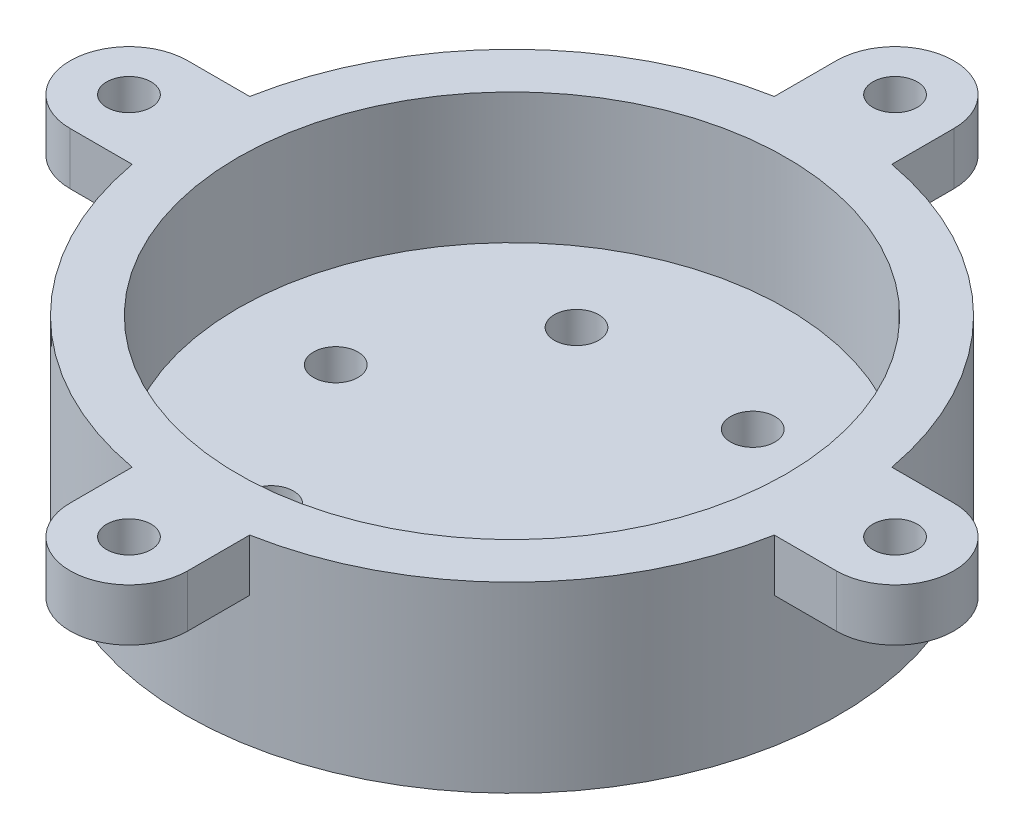
from build123d import *

# Parameters (mm, degrees)
SKETCH_1_R                   = 25
SKETCH_1_R_2                 = 21
EXTRUDE_1_DEPTH              = 10
EXTRUDE_START                = -4
SKETCH_1_5_R                 = 25
EXTRUDE_2_DEPTH              = 4
EXTRUDE_3_DEPTH              = 4
PATTERN_CIRCULAR_1_COUNT     = 6
HOLE_WIZARD_M3_2_D           = 3.4
HOLE_WIZARD_M3_2_CSINK_D     = 3.45
HOLE_WIZARD_M3_2_CSINK_ANGLE = 90


# Read off the part's stored shape, not the designer's step: M3 间隙孔1
with BuildPart() as part:
    # 草图1 → 拉伸-薄壁1 (new body)
    with BuildSketch(Plane(origin=(0, 0, 0), x_dir=(1, 0, 0), z_dir=(0, 1, 0))):
        Circle(SKETCH_1_R)
        Circle(SKETCH_1_R_2, mode=Mode.SUBTRACT)
    extrude(amount=EXTRUDE_1_DEPTH)

    # 草图1<5> → 凸台-拉伸2 (add)
    with BuildSketch(Plane(origin=(0, 0, 0), x_dir=(1, 0, 0), z_dir=(0, 1, 0)).offset(EXTRUDE_START)):
        with Locations(Location((0, 0, 0), (0, 0, 270))):
            Circle(SKETCH_1_5_R)
    extrude(amount=EXTRUDE_2_DEPTH)

    # 草图3 → 凸台-拉伸3 (add)
    with BuildSketch(Plane(origin=(0, 10, 0), x_dir=(1, 0, 0), z_dir=(0, 1, 0)).offset(EXTRUDE_START)):
        with BuildLine():
            ThreePointArc((-29.34, 4.5), (-33.84, 0), (-29.34, -4.5))
            Line((-29.34, -4.5), (-24.591665255, -4.5))
            ThreePointArc((-24.591665255, -4.5), (-25, 0), (-24.591665255, 4.5))
            Line((-24.591665255, 4.5), (-29.34, 4.5))
        make_face()
        with BuildLine():
            ThreePointArc((24.591665255, 4.5), (24.897707037, 2.259244191), (25, 0))
            ThreePointArc((25, 0), (24.897707037, -2.259244191), (24.591665255, -4.5))
            Line((24.591665255, -4.5), (29.34, -4.5))
            ThreePointArc((29.34, -4.5), (33.84, 0), (29.34, 4.5))
            Line((29.34, 4.5), (24.591665255, 4.5))
        make_face()
        with BuildLine():
            Line((-4.5, 29.34), (-4.5, 24.591665255))
            ThreePointArc((-4.5, 24.591665255), (0, 25), (4.5, 24.591665255))
            Line((4.5, 24.591665255), (4.5, 29.34))
            ThreePointArc((4.5, 29.34), (0, 33.84), (-4.5, 29.34))
        make_face()
        with BuildLine():
            ThreePointArc((4.5, -24.591665255), (0, -25), (-4.5, -24.591665255))
            Line((-4.5, -24.591665255), (-4.5, -29.34))
            ThreePointArc((-4.5, -29.34), (0, -33.84), (4.5, -29.34))
            Line((4.5, -29.34), (4.5, -24.591665255))
        make_face()
    extrude(amount=EXTRUDE_3_DEPTH)

    # M3 间隙孔1 outline → M3 间隙孔1 (revolve, cut)
    with BuildSketch(Plane(origin=(-13.5, 0, 0), x_dir=(1, 0, 0), z_dir=(0, 0, 1))):
        Polygon((1.7, -3.975), (1.7, 0), (0, 0), (0, -4), (1.725, -4), align=None)
    hole_wizard_m3_1 = revolve(axis=Axis((-13.5, 0, 0), (0, 1, 0)), mode=Mode.SUBTRACT)

    # 阵列(圆周)1: M3 间隙孔1 ×6 about axis
    pattern_circular_1_axis = Axis((0, 0, 0), (0, 1, 0))
    for i in range(1, PATTERN_CIRCULAR_1_COUNT):
        add(hole_wizard_m3_1.rotate(pattern_circular_1_axis, i * 360 / PATTERN_CIRCULAR_1_COUNT), mode=Mode.SUBTRACT)

    # M3 间隙孔2 (through all)
    with Locations(Plane(origin=(0, 6, 0), x_dir=(-1, 0, 0), z_dir=(0, -1, 0))):
        with Locations((0, 29.34), (29.34, 0), (0, -29.34), (-29.34, 0)):
            CounterSinkHole(HOLE_WIZARD_M3_2_D / 2, HOLE_WIZARD_M3_2_CSINK_D / 2, counter_sink_angle=HOLE_WIZARD_M3_2_CSINK_ANGLE)


solid = part.part
